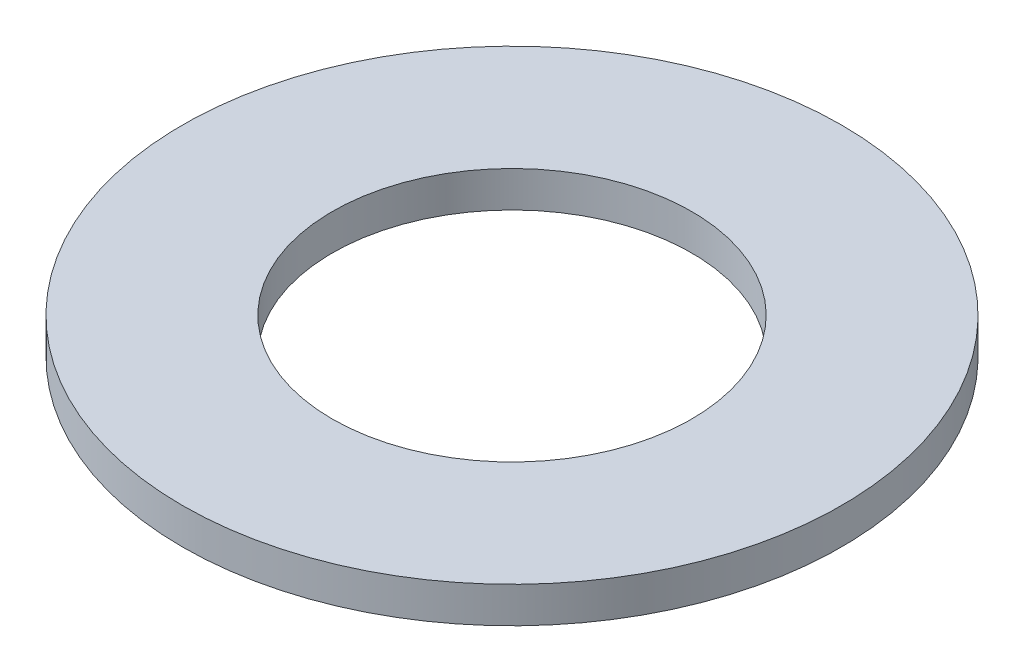
from build123d import *

# Parameters (mm, degrees)
SKETCH1_R           = 55
BOSS_EXTRUDE1_DEPTH = 6
SKETCH2_R           = 30
CUT_EXTRUDE1_DEPTH  = 79.012819459


with BuildPart() as part:
    # Sketch1 → Boss-Extrude1 (new body)
    with BuildSketch(Plane(origin=(0, 0, 0), x_dir=(1, 0, 0), z_dir=(0, 1, 0))):
        Circle(SKETCH1_R)
    extrude(amount=BOSS_EXTRUDE1_DEPTH)

    # Sketch2 → Cut-Extrude1 (cut, through all)
    with BuildSketch(Plane(origin=(0, 0, 0), x_dir=(1, 0, 0), z_dir=(0, 1, 0))):
        Circle(SKETCH2_R)
    extrude(amount=CUT_EXTRUDE1_DEPTH, mode=Mode.SUBTRACT)


solid = part.part
